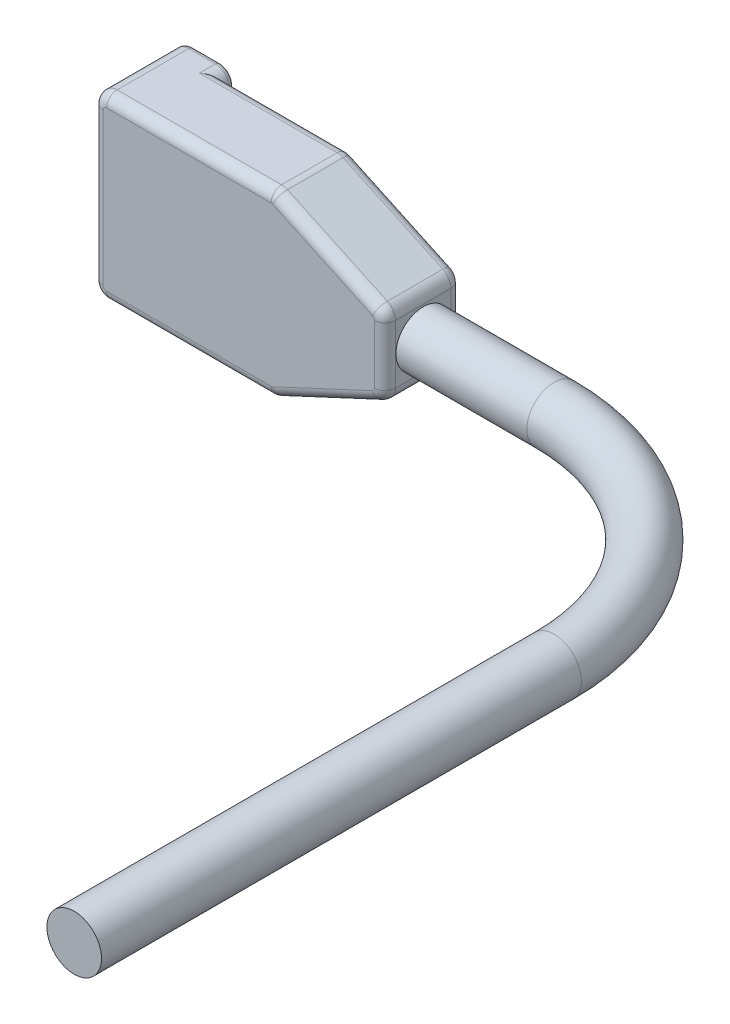
from build123d import *

# Parameters (mm, degrees)
BOSS_EXTRUDE1_DEPTH = 13.081
CUT_EXTRUDE1_START  = -11.1252
CUT_EXTRUDE1_DEPTH  = 11.1252
FILLET1_R           = 2.032
FILLET2_R           = 0.762
FILLET6_R           = 1.524
SKETCH6_R           = 3.9751


# Read off the part's stored shape, not the designer's step: Cut-Extrude1
with BuildPart() as part:
    # Sketch1 → Boss-Extrude1 (new, symmetric)
    with BuildSketch(Plane(origin=(0, 0, 0), x_dir=(1, 0, 0), z_dir=(0, 1, 0))):
        Polygon((27.9502, 12.7), (27.9502, 11.1252), (63.561, 11.1252), (63.561, 0), (20, 0), (20, 12.7), align=None)
    extrude(amount=BOSS_EXTRUDE1_DEPTH, both=True)

    # Cut-Extrude1 outline → Cut-Extrude1 (cut)
    with BuildSketch(Plane.XY.offset(CUT_EXTRUDE1_START)):
        Polygon((62.545, 5.5626), (62.545, -5.5626), (46.421739169, -13.081), (63.561, -13.081), (63.561, 13.081), (46.421739169, 13.081), align=None)
    extrude(amount=CUT_EXTRUDE1_DEPTH, mode=Mode.SUBTRACT)

    # Fillet1
    fillet1_edges = [part.edges().sort_by_distance(p)[0] for p in [
        (27.9502, 13.081, -11.9126),
        (46.421739169, -13.081, -5.5626),
        (46.421739169, 13.081, -5.5626),
        (62.545, -5.5626, -5.5626),
        (62.545, 5.5626, -5.5626),
        (20, 13.081, -6.35),
        (27.9502, -13.081, -11.9126),
        (20, -13.081, -6.35),
    ]]
    fillet(fillet1_edges, radius=FILLET1_R)

    # Fillet2
    fillet2_edges = [part.edges().sort_by_distance(p)[0] for p in [
        (23.9751, -13.081, -12.7),
        (23.9751, 13.081, -12.7),
        (27.9502, 0, -12.7),
        (20, 0, -12.7),
        (20.595159021, -12.485840979, -12.7),
        (20.595159021, 12.485840979, -12.7),
        (27.355040979, 12.485840979, -12.7),
        (27.355040979, -12.485840979, -12.7),
    ]]
    fillet(fillet2_edges, radius=FILLET2_R)

    # Fillet6
    fillet6_edges = [part.edges().sort_by_distance(p)[0] for p in [
        (35.944727807, -13.081, -11.1252),
        (34.001627807, -13.081, 0),
        (54.100888115, 9.500154038, 0),
        (34.001627807, 13.081, 0),
        (20, 0, 0),
        (54.100888115, -9.500154038, 0),
        (62.545, 0, 0),
        (62.226771418, 5.359866034, 0),
        (62.226771418, -5.359866034, 0),
        (20.595159021, -12.485840979, 0),
        (20.595159021, 12.485840979, 0),
        (46.41106091, 13.032833486, 0),
        (46.41106091, -13.032833486, 0),
        (54.100888115, -9.500154038, -11.1252),
        (54.100888115, 9.500154038, -11.1252),
        (62.545, 0, -11.1252),
        (35.944727807, 13.081, -11.1252),
        (62.226771418, 5.359866034, -11.1252),
        (62.226771418, -5.359866034, -11.1252),
        (46.41106091, 13.032833486, -11.1252),
        (46.41106091, -13.032833486, -11.1252),
    ]]
    fillet(fillet6_edges, radius=FILLET6_R)

    # Sweep1: sweep along a path in Sketch4
    with BuildLine(Plane(origin=(0, 0, 0), x_dir=(1, 0, 0), z_dir=(0, 1, 0))) as sweep1_path:
        Line((62.545, 5.5626), (81.595, 5.5626))
        ThreePointArc((81.595, 5.5626), (104.045640303, -3.736759697), (113.345, -26.1874))
        Line((113.345, -26.1874), (113.345, -96.0374))
    # Sketch6 → Sweep1 (sweep)
    with BuildSketch(Plane(origin=(62.545, 0, 0), x_dir=(0, 0, -1), z_dir=(1, 0, 0))):
        with Locations((5.5626, 0)):
            Circle(SKETCH6_R)
    sweep(path=sweep1_path.line)


solid = part.part
